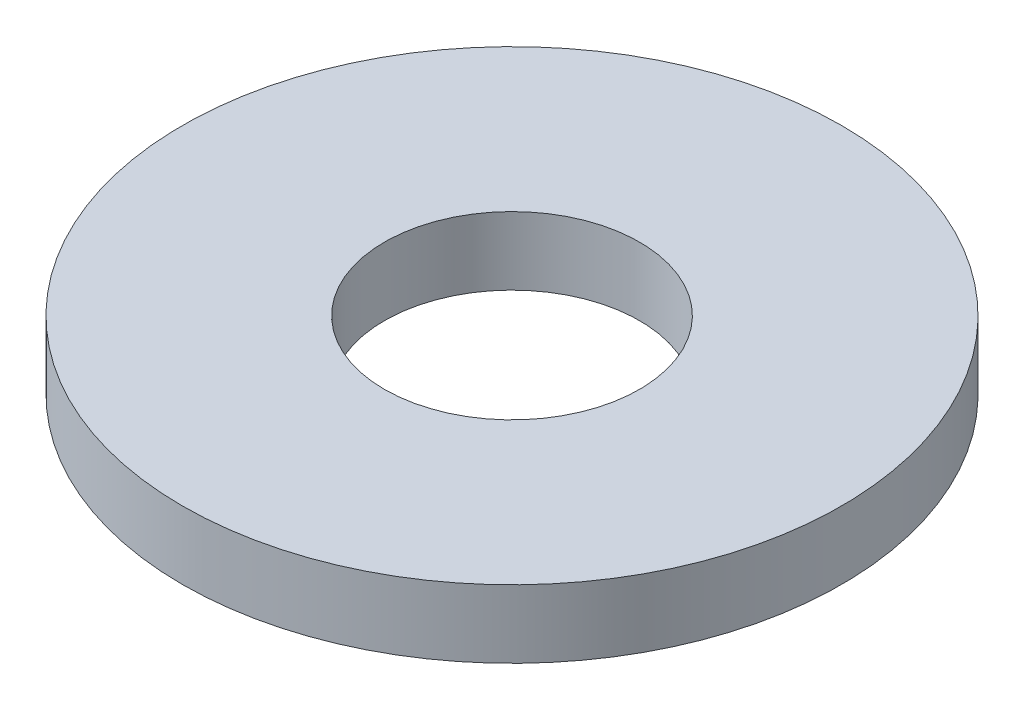
from build123d import *

# Parameters (mm, degrees)
SKETCH1_R           = 77.5
BOSS_EXTRUDE1_DEPTH = 16
SKETCH2_R           = 30
CUT_EXTRUDE1_DEPTH  = 111.763261057


with BuildPart() as part:
    # Sketch1 → Boss-Extrude1 (new body)
    with BuildSketch(Plane(origin=(0, 0, 0), x_dir=(1, 0, 0), z_dir=(0, 1, 0))):
        Circle(SKETCH1_R)
    extrude(amount=BOSS_EXTRUDE1_DEPTH)

    # Sketch2 → Cut-Extrude1 (cut, through all)
    with BuildSketch(Plane(origin=(0, 0, 0), x_dir=(1, 0, 0), z_dir=(0, 1, 0))):
        Circle(SKETCH2_R)
    extrude(amount=CUT_EXTRUDE1_DEPTH, mode=Mode.SUBTRACT)


solid = part.part
